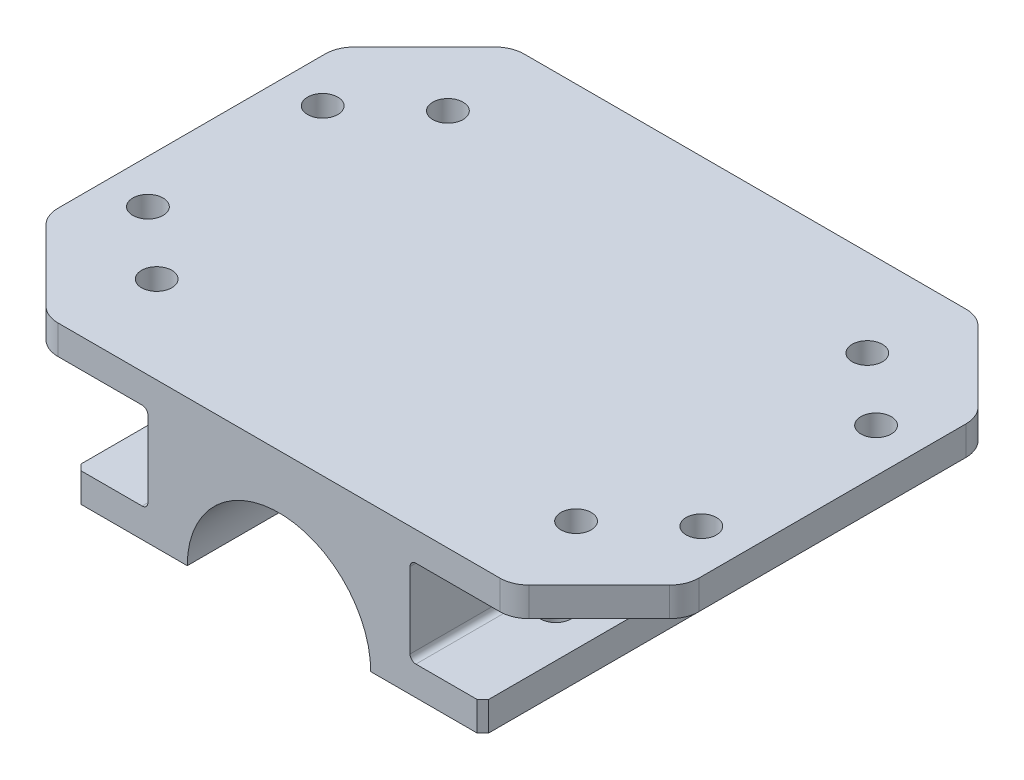
from build123d import *

# Parameters (mm, degrees)
EXTRUDE_2_DEPTH     = 40
FILLET_1_R          = 1
SKETCH_3_R          = 2.6
CUT_EXTRUDE_2_DEPTH = 20
CHAMFER_2_SIZE      = 1
SKETCH_4_R          = 2.6
CUT_EXTRUDE_3_DEPTH = 10
SKETCH_5_R          = 2.6
CUT_EXTRUDE_4_DEPTH = 10
CHAMFER_3_SIZE      = 15
FILLET_2_R          = 5


with BuildPart() as part:
    # 草图2 → 凸台-拉伸2 (new, symmetric)
    with BuildSketch(Plane.XY):
        with BuildLine():
            Line((25, 0), (15.75, 0))
            ThreePointArc((15.75, 0), (0, 15.75), (-15.75, 0))
            Line((-15.75, 0), (-25, 0))
            Line((-25, 0), (-35, 0))
            Line((-35, 0), (-35, 5))
            Line((-35, 5), (-22.5, 5))
            Line((-22.5, 5), (-22.5, 20))
            Line((-22.5, 20), (-35, 20))
            Line((-35, 20), (-55, 20))
            Line((-55, 20), (-55, 25))
            Line((-55, 25), (-35, 25))
            Line((-35, 25), (35, 25))
            Line((35, 25), (55, 25))
            Line((55, 25), (55, 20))
            Line((55, 20), (35, 20))
            Line((35, 20), (22.5, 20))
            Line((22.5, 20), (22.5, 5))
            Line((22.5, 5), (35, 5))
            Line((35, 5), (35, 0))
            Line((35, 0), (25, 0))
        make_face()
    extrude(amount=EXTRUDE_2_DEPTH, both=True)

    # 圆角1
    fillet_1_edges = [part.edges().sort_by_distance(p)[0] for p in [
        (22.5, 20, 0),
        (22.5, 5, 0),
        (-22.5, 20, 0),
        (-22.5, 5, 0),
    ]]
    fillet(fillet_1_edges, radius=FILLET_1_R)

    # 草图3 → 切除-拉伸2 (cut)
    with BuildSketch(Plane.XZ.offset(-20)):
        with Locations((-27.5, 20)):
            Circle(SKETCH_3_R)
        with Locations((27.5, 20)):
            Circle(SKETCH_3_R)
        with Locations((27.5, -20)):
            Circle(SKETCH_3_R)
        with Locations((-27.5, -20)):
            Circle(SKETCH_3_R)
    extrude(amount=CUT_EXTRUDE_2_DEPTH, mode=Mode.SUBTRACT)

    # 倒角2
    chamfer_2_edges = [part.edges().sort_by_distance(p)[0] for p in [
        (-35, 2.5, 40),
        (35, 2.5, 40),
        (-35, 2.5, -40),
        (35, 2.5, -40),
    ]]
    chamfer(chamfer_2_edges, length=CHAMFER_2_SIZE)

    # 草图4 → 切除-拉伸3 (cut)
    with BuildSketch(Plane(origin=(0, 25, 0), x_dir=(1, 0, 0), z_dir=(0, 1, 0))):
        with Locations((36, -25)):
            Circle(SKETCH_4_R)
        with Locations((-36, -25)):
            Circle(SKETCH_4_R)
        with Locations((36, 25)):
            Circle(SKETCH_4_R)
        with Locations((-36, 25)):
            Circle(SKETCH_4_R)
    extrude(amount=-CUT_EXTRUDE_3_DEPTH, mode=Mode.SUBTRACT)

    # 草图5 → 切除-拉伸4 (cut)
    with BuildSketch(Plane(origin=(0, 25, 0), x_dir=(1, 0, 0), z_dir=(0, 1, 0))):
        with Locations((-47.5, 15)):
            Circle(SKETCH_5_R)
        with Locations((47.5, 15)):
            Circle(SKETCH_5_R)
        with Locations((47.5, -15)):
            Circle(SKETCH_5_R)
        with Locations((-47.5, -15)):
            Circle(SKETCH_5_R)
    extrude(amount=-CUT_EXTRUDE_4_DEPTH, mode=Mode.SUBTRACT)

    # 倒角3
    chamfer_3_edges = [part.edges().sort_by_distance(p)[0] for p in [
        (55, 22.5, -40),
        (55, 22.5, 40),
        (-55, 22.5, -40),
        (-55, 22.5, 40),
    ]]
    chamfer(chamfer_3_edges, length=CHAMFER_3_SIZE)

    # 圆角2
    fillet_2_edges = [part.edges().sort_by_distance(p)[0] for p in [
        (-55, 22.5, -25),
        (-40, 22.5, -40),
        (40, 22.5, -40),
        (55, 22.5, -25),
        (55, 22.5, 25),
        (40, 22.5, 40),
        (-40, 22.5, 40),
        (-55, 22.5, 25),
    ]]
    fillet(fillet_2_edges, radius=FILLET_2_R)


solid = part.part
